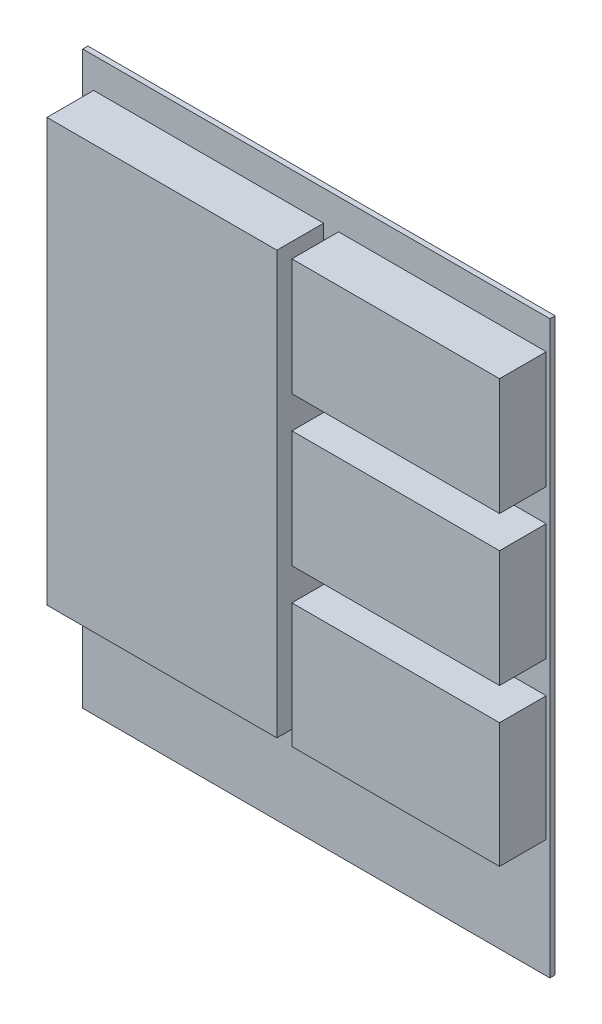
from build123d import *

# Parameters (mm, degrees)
SKETCH1_W    = 180
SKETCH1_H    = 220
BASE_DEPTH   = 2
SKETCH2_W    = 88.607017387
SKETCH2_H    = 162.747582956
SKETCH2_W_2  = 80
SKETCH2_H_2  = 45
SKETCH2_H_3  = 47.956874403
BOARDS_DEPTH = 20


with BuildPart() as part:
    # Sketch1 → Base (new body)
    with BuildSketch(Plane.XY):
        with Locations((90, 110)):
            Rectangle(SKETCH1_W, SKETCH1_H)
    extrude(amount=BASE_DEPTH)

    # Sketch2 → Boards (add)
    with BuildSketch(Plane.XY):
        with Locations((48.5089102, 126.904245713)):
            Rectangle(SKETCH2_W, SKETCH2_H)
        with Locations((138.596199401, 185.778037191)):
            Rectangle(SKETCH2_W_2, SKETCH2_H_2)
        with Locations((138.596199401, 128.382682915)):
            Rectangle(SKETCH2_W_2, SKETCH2_H_2)
        with Locations((138.596199401, 69.508891437)):
            Rectangle(SKETCH2_W_2, SKETCH2_H_3)
    extrude(amount=BOARDS_DEPTH)


solid = part.part
